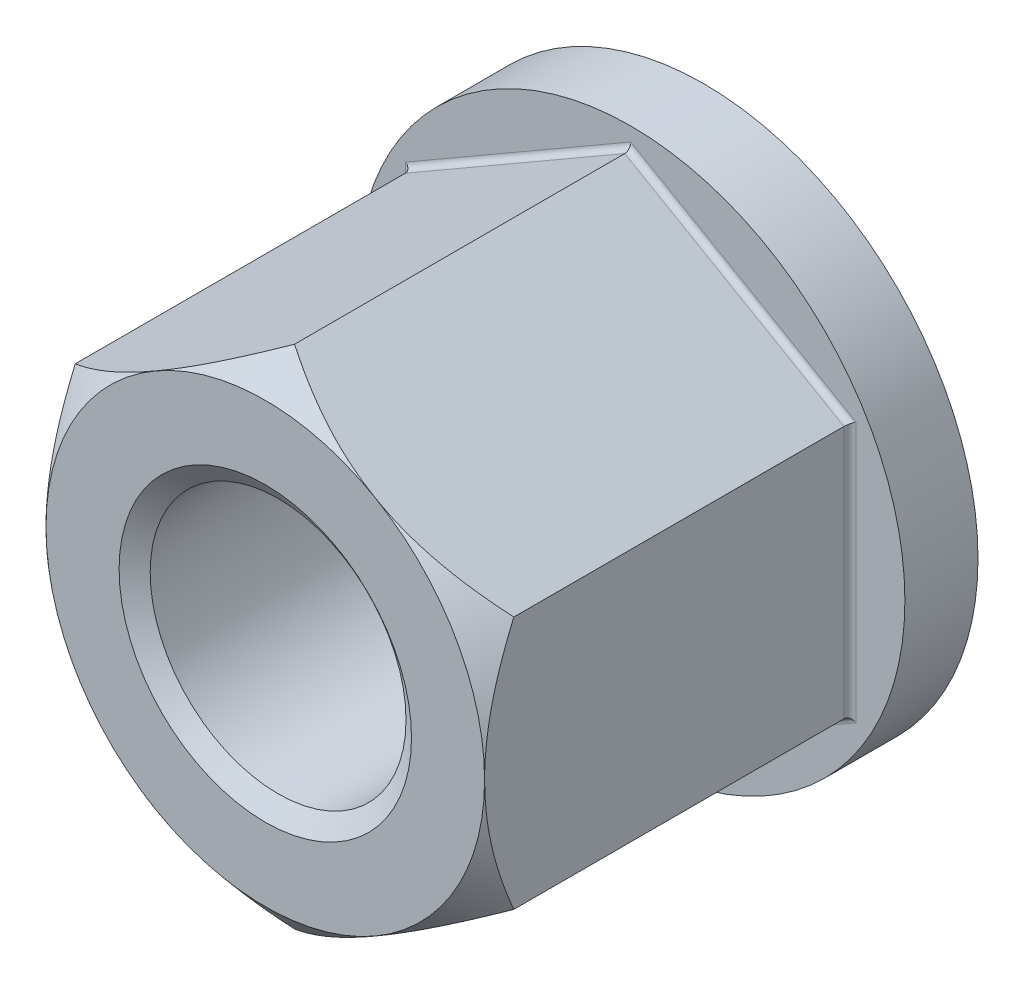
from build123d import *

# Parameters (mm, degrees)
BASENUT_START = -36
BASENUTSKE_R  = 10.5
BASENUT_DEPTH = 36
COLLARSKE_W   = 6
COLLARSKE_H   = 12
FILLET_2_R    = 0.5


# Read off the part's stored shape, not the designer's step: ThreadSchematic
with BuildPart() as part:
    # BaseNutSke → BaseNut (new body)
    with BuildSketch(Plane.XY.offset(BASENUT_START)):
        Polygon((18, 10.392304845), (18, -10.392304845), (0, -20.784609691), (-18, -10.392304845), (-18, 10.392304845), (0, 20.784609691), align=None)
        Circle(BASENUTSKE_R, mode=Mode.SUBTRACT)
    extrude(amount=BASENUT_DEPTH)

    # Sketch5 (on Right Plane) → EndChamfer (revolve, cut)
    with BuildSketch(Plane(origin=(0, 0, 0), x_dir=(0, 0, -1), z_dir=(1, 0, 0))):
        Polygon((35.9746, 12), (34.819257562, 10.35), (36.0254, 10.35), (36.0254, 12), align=None)
    revolve(axis=Axis((0, 10.35, -36.0254), (0, 0, 1)), mode=Mode.SUBTRACT)

    # CollarSke → Collar (revolve)
    with BuildSketch(Plane(origin=(0, 0, 0), x_dir=(0, 0, -1), z_dir=(1, 0, 0)), mode=Mode.PRIVATE) as collar_sk:
        with Locations((33, 16.5)):
            Rectangle(COLLARSKE_W, COLLARSKE_H)
    revolve(collar_sk.sketch.rotate(Axis((0, 0, 0), (0, 0, -1)), 90), axis=Axis((0, 0, 0), (0, 0, -1)))

    # Sketch3 → Chamfer 2 (revolve, cut)
    with BuildSketch(Plane(origin=(0, 0, 0), x_dir=(0, 0, -1), z_dir=(1, 0, 0))):
        Polygon((2.4, 33.484609691), (-12.7, 33.484609691), (-12.7, 18), (0, 18), (2.4, 20.784609691), align=None)
    revolve(axis=Axis((0, 0, 0), (0, 0, -1)), mode=Mode.SUBTRACT)

    # ThreadSchematic outline → ThreadSchematic (revolve, cut)
    with BuildSketch(Plane.XZ):
        Polygon((10.5, 0), (10.5, -1.050311307), (12, 0), align=None)
        Polygon((12, -35.9746), (10.5, -34.924288693), (10.5, -36), (12, -36), align=None)
    revolve(axis=Axis((0, 0, 0), (0, 0, 1)), mode=Mode.SUBTRACT)

    # Fillet 2
    fillet_2_edges = [part.edges().sort_by_distance(p)[0] for p in [
        (9, 15.588457268, -30),
        (-9, 15.588457268, -30),
        (-18, 0, -30),
        (-9, -15.588457268, -30),
        (9, -15.588457268, -30),
        (18, 0, -30),
    ]]
    fillet(fillet_2_edges, radius=FILLET_2_R)


solid = part.part
